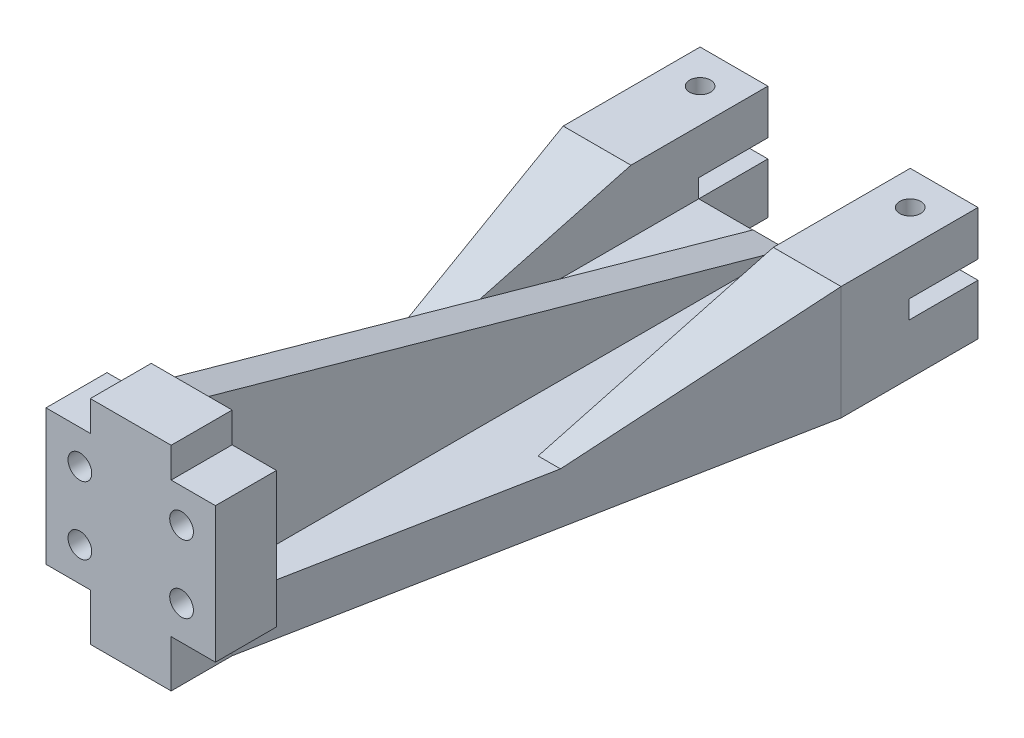
from build123d import *

# Parameters (mm, degrees)
SKETCH1_W            = 41
SKETCH1_H            = 100.5
BOSS_EXTRUDE1_DEPTH  = 5
SKETCH2_W            = 21
SKETCH2_H            = 10.2
CUT_EXTRUDE1_DEPTH   = 109.656569061
SKETCH9_R            = 1.75
CUT_EXTRUDE4_DEPTH   = 109.656569061
CUT_EXTRUDE5_DEPTH   = 109.656569061
BOSS_EXTRUDE4_DEPTH  = 23.9
SKETCH16_W           = 5
SKETCH16_H           = 85.3
BOSS_EXTRUDE5_DEPTH  = 23.9
CUT_EXTRUDE8_DEPTH   = 108.072218619
BOSS_EXTRUDE6_DEPTH  = 28.9
SKETCH25_W           = 6.53486924
SKETCH25_H           = 4.45
CUT_EXTRUDE9_DEPTH   = 108.872424651
SKETCH26_R           = 1.75
CUT_EXTRUDE10_DEPTH  = 113.323016341
SKETCH27_R           = 1.75
BOSS_EXTRUDE7_DEPTH  = 2.5
BOSS_EXTRUDE8_START  = 4
SKETCH28_R           = 1.75
BOSS_EXTRUDE8_DEPTH  = 4
SKETCH29_W           = 10
SKETCH29_H           = 10
BOSS_EXTRUDE9_DEPTH  = 2.7
SKETCH30_W           = 10
SKETCH30_H           = 20.2
BOSS_EXTRUDE10_DEPTH = 6.6
SKETCH31_R           = 1.55
CUT_EXTRUDE11_DEPTH  = 6.6
CHAMFER2_SIZE        = 34.7
CHAMFER2_SIZE_2      = 9.297836977


with BuildPart() as part:
    # Sketch1 → Boss-Extrude1 (new body)
    with BuildSketch(Plane(origin=(0, 0, 0), x_dir=(1, 0, 0), z_dir=(0, 1, 0))):
        with Locations((20.5, 50.25)):
            Rectangle(SKETCH1_W, SKETCH1_H)
    extrude(amount=BOSS_EXTRUDE1_DEPTH)

    # Sketch2 → Cut-Extrude1 (cut, through all)
    with BuildSketch(Plane(origin=(0, 5, 0), x_dir=(1, 0, 0), z_dir=(0, 1, 0))):
        with Locations((20.5, 95.4)):
            Rectangle(SKETCH2_W, SKETCH2_H)
    extrude(amount=-CUT_EXTRUDE1_DEPTH, mode=Mode.SUBTRACT)

    # Sketch9 → Cut-Extrude4 (cut, through all)
    with BuildSketch(Plane(origin=(0, 5, 0), x_dir=(1, 0, 0), z_dir=(0, 1, 0))):
        with Locations(Location((5, 95.5, 0), (0, 0, 270))):
            Circle(SKETCH9_R)
        with Locations(Location((36, 95.5, 0), (0, 0, 270))):
            Circle(SKETCH9_R)
    extrude(amount=-CUT_EXTRUDE4_DEPTH, mode=Mode.SUBTRACT)

    # Sketch11 → Cut-Extrude5 (cut, through all)
    with BuildSketch(Plane(origin=(0, 5, 0), x_dir=(1, 0, 0), z_dir=(0, 1, 0))):
        Polygon((15.5, 0), (0, 80.3), (0, 0), align=None)
        Polygon((25.5, 0), (41, 80.3), (41, 0), align=None)
    extrude(amount=-CUT_EXTRUDE5_DEPTH, mode=Mode.SUBTRACT)

    # Sketch12 → Boss-Extrude4 (add)
    with BuildSketch(Plane(origin=(0, 5, 0), x_dir=(1, 0, 0), z_dir=(0, 1, 0))):
        Polygon((25.5, 0), (15.5, 0), (14.53486924, 5), (26.46513076, 5), align=None)
    extrude(amount=BOSS_EXTRUDE4_DEPTH)

    # Sketch16 → Boss-Extrude5 (add)
    with BuildSketch(Plane(origin=(0, 5, 0), x_dir=(1, 0, 0), z_dir=(0, 1, 0))):
        with Locations((20.5, 47.65)):
            Rectangle(SKETCH16_W, SKETCH16_H)
    extrude(amount=BOSS_EXTRUDE5_DEPTH)

    # Sketch17 → Cut-Extrude8 (cut, through all)
    with BuildSketch(Plane.ZY.offset(-18)):
        Polygon((-90.4, 5), (-5, 28.9), (-90.3, 28.9), align=None)
    extrude(amount=-CUT_EXTRUDE8_DEPTH, mode=Mode.SUBTRACT)

    # Sketch23 → Boss-Extrude6 (add)
    with BuildSketch(Plane(origin=(0, 28.9, 0), x_dir=(1, 0, 0), z_dir=(0, 1, 0))):
        Polygon((26.46513076, 5), (33, 5), (33, 0), (25.5, 0), align=None)
        Polygon((14.53486924, 5), (8, 5), (8, 0), (15.5, 0), align=None)
    extrude(amount=-BOSS_EXTRUDE6_DEPTH)

    # Sketch25 → Cut-Extrude9 (cut, through all)
    with BuildSketch(Plane(origin=(0, 0, -5), x_dir=(-1, 0, 0), z_dir=(0, 0, -1))):
        with Locations((-11.26743462, 2.225)):
            Rectangle(SKETCH25_W, SKETCH25_H)
        with Locations((-29.73256538, 2.225)):
            Rectangle(SKETCH25_W, SKETCH25_H)
        with Locations((-11.26743462, 26.675)):
            Rectangle(SKETCH25_W, SKETCH25_H)
        with Locations((-29.73256538, 26.675)):
            Rectangle(SKETCH25_W, SKETCH25_H)
    extrude(amount=-CUT_EXTRUDE9_DEPTH, mode=Mode.SUBTRACT)

    # Sketch26 → Cut-Extrude10 (cut, through all)
    with BuildSketch(Plane.XY):
        with Locations((13, 19.45)):
            Circle(SKETCH26_R)
        with Locations((28, 19.45)):
            Circle(SKETCH26_R)
        with Locations((13, 9.45)):
            Circle(SKETCH26_R)
        with Locations((28, 9.45)):
            Circle(SKETCH26_R)
    extrude(amount=-CUT_EXTRUDE10_DEPTH, mode=Mode.SUBTRACT)

    # Sketch27 → Boss-Extrude7 (add)
    with BuildSketch(Plane.XZ):
        Polygon((26.46513076, -5), (26.46513076, 0), (14.53486924, 0), (14.53486924, -5), (0, -80.3), (0, -100.5), (10, -100.5), (10, -90.3), (31, -90.3), (31, -100.5), (41, -100.5), (41, -80.3), align=None)
        with Locations(Location((5, -95.5, 0), (0, 0, 90))):
            Circle(SKETCH27_R, mode=Mode.SUBTRACT)
        with Locations(Location((36, -95.5, 0), (0, 0, 90))):
            Circle(SKETCH27_R, mode=Mode.SUBTRACT)
    extrude(amount=BOSS_EXTRUDE7_DEPTH)

    # Sketch28 → Boss-Extrude8 (add)
    with BuildSketch(Plane.XY.offset(BOSS_EXTRUDE8_START)):
        Polygon((26.46513076, -2.5), (26.46513076, 4.45), (33, 4.45), (33, 24.45), (26.46513076, 24.45), (26.46513076, 28.9), (14.53486924, 28.9), (14.53486924, 24.45), (8, 24.45), (8, 4.45), (14.53486924, 4.45), (14.53486924, -2.5), align=None)
        with Locations((28, 9.45)):
            Circle(SKETCH28_R, mode=Mode.SUBTRACT)
        with Locations((13, 9.45)):
            Circle(SKETCH28_R, mode=Mode.SUBTRACT)
        with Locations((28, 19.45)):
            Circle(SKETCH28_R, mode=Mode.SUBTRACT)
        with Locations((13, 19.45)):
            Circle(SKETCH28_R, mode=Mode.SUBTRACT)
    extrude(amount=-BOSS_EXTRUDE8_DEPTH)

    # Sketch29 → Boss-Extrude9 (add)
    with BuildSketch(Plane(origin=(0, 5, 0), x_dir=(1, 0, 0), z_dir=(0, 1, 0))):
        with Locations((36, 85.3)):
            Rectangle(SKETCH29_W, SKETCH29_H)
        with Locations((5, 85.3)):
            Rectangle(SKETCH29_W, SKETCH29_H)
    extrude(amount=BOSS_EXTRUDE9_DEPTH)

    # Sketch30 → Boss-Extrude10 (add)
    with BuildSketch(Plane(origin=(0, 7.7, 0), x_dir=(1, 0, 0), z_dir=(0, 1, 0))):
        with Locations((5, 90.4)):
            Rectangle(SKETCH30_W, SKETCH30_H)
        with Locations((36, 90.4)):
            Rectangle(SKETCH30_W, SKETCH30_H)
    extrude(amount=BOSS_EXTRUDE10_DEPTH)

    # Sketch31 → Cut-Extrude11 (cut)
    with BuildSketch(Plane(origin=(0, 14.3, 0), x_dir=(1, 0, 0), z_dir=(0, 1, 0))):
        with Locations(Location((36, 95.5, 0), (0, 0, 270))):
            Circle(SKETCH31_R)
        with Locations(Location((5, 95.5, 0), (0, 0, 270))):
            Circle(SKETCH31_R)
    extrude(amount=-CUT_EXTRUDE11_DEPTH, mode=Mode.SUBTRACT)

    # Chamfer2
    # the kernel refuses this chamfer: 34.7, 9.297836977 mm, written as the material it adds along each edge
    with BuildSketch(Plane(origin=(41, 5, -80.3), x_dir=(0, -0.009967146577156432, 0.9999503267608395), z_dir=(-1, 0, 0))) as chamfer2_piece_1_section:
        Polygon((CHAMFER2_SIZE * 0.999950326761, CHAMFER2_SIZE * 0.00996714657716), (-CHAMFER2_SIZE_2 * 0.00996714657754, CHAMFER2_SIZE_2 * 0.9999503268), (0, 0), align=None)
    chamfer2_piece_1 = extrude(amount=10, mode=Mode.PRIVATE)
    chamfer2_piece_1 = split(chamfer2_piece_1, bisect_by=Plane(origin=(38.932419972, 8.049756371, -69.588601533), z_dir=(-0.9818753883596208, 0, -0.1895276278900885)), keep=Keep.TOP, mode=Mode.PRIVATE)
    add(chamfer2_piece_1)
    with BuildSketch(Plane(origin=(41, 5, -80.3), x_dir=(0, -0.009967146577156432, 0.9999503267608395), z_dir=(-1, 0, 0))) as chamfer2_piece_2_section:
        Polygon((CHAMFER2_SIZE * 0.999950326761, CHAMFER2_SIZE * 0.00996714657716), (-CHAMFER2_SIZE_2 * 0.00996714657754, CHAMFER2_SIZE_2 * 0.9999503268), (0, 0), align=None)
    chamfer2_piece_2 = extrude(amount=100.106238486, mode=Mode.PRIVATE)
    chamfer2_piece_2 = split(chamfer2_piece_2, bisect_by=Plane(origin=(2.067580028, 8.049756371, -69.588601533), z_dir=(0.9818753883596207, 0, -0.18952762789008884)), keep=Keep.TOP, mode=Mode.PRIVATE)
    chamfer2_piece_2 = split(chamfer2_piece_2, bisect_by=Plane(origin=(0, 8.049756371, -70.340774245), z_dir=(1, 0, 0)), keep=Keep.TOP, mode=Mode.PRIVATE)
    chamfer2_piece_2 = split(chamfer2_piece_2, bisect_by=Plane(origin=(10, 8.049756371, -70.340774245), z_dir=(-1, 0, 0)), keep=Keep.TOP, mode=Mode.PRIVATE)
    add(chamfer2_piece_2)
    with BuildSketch(Plane(origin=(0, 5, -80.3), x_dir=(0, -0.009967146577156432, 0.9999503267608395), z_dir=(1, 0, 0))) as chamfer2_piece_3_section:
        Polygon((CHAMFER2_SIZE * 0.999950326761, -CHAMFER2_SIZE * 0.00996714657716), (-CHAMFER2_SIZE_2 * 0.00996714657754, -CHAMFER2_SIZE_2 * 0.9999503268), (0, 0), align=None)
    chamfer2_piece_3 = extrude(amount=10, mode=Mode.PRIVATE)
    chamfer2_piece_3 = split(chamfer2_piece_3, bisect_by=Plane(origin=(2.067580028, 8.049756371, -69.588601533), z_dir=(0.9818753883596207, 0, -0.18952762789008884)), keep=Keep.TOP, mode=Mode.PRIVATE)
    add(chamfer2_piece_3)
    with BuildSketch(Plane(origin=(0, 5, -80.3), x_dir=(0, -0.009967146577156432, 0.9999503267608395), z_dir=(1, 0, 0))) as chamfer2_piece_4_section:
        Polygon((CHAMFER2_SIZE * 0.999950326761, -CHAMFER2_SIZE * 0.00996714657716), (-CHAMFER2_SIZE_2 * 0.00996714657754, -CHAMFER2_SIZE_2 * 0.9999503268), (0, 0), align=None)
    chamfer2_piece_4 = extrude(amount=100.106238486, mode=Mode.PRIVATE)
    chamfer2_piece_4 = split(chamfer2_piece_4, bisect_by=Plane(origin=(38.932419972, 8.049756371, -69.588601533), z_dir=(-0.9818753883596208, 0, -0.1895276278900885)), keep=Keep.TOP, mode=Mode.PRIVATE)
    chamfer2_piece_4 = split(chamfer2_piece_4, bisect_by=Plane(origin=(31, 8.049756371, -70.340774245), z_dir=(1, 0, 0)), keep=Keep.TOP, mode=Mode.PRIVATE)
    chamfer2_piece_4 = split(chamfer2_piece_4, bisect_by=Plane(origin=(41, 8.049756371, -70.340774245), z_dir=(-1, 0, 0)), keep=Keep.TOP, mode=Mode.PRIVATE)
    add(chamfer2_piece_4)


solid = part.part
